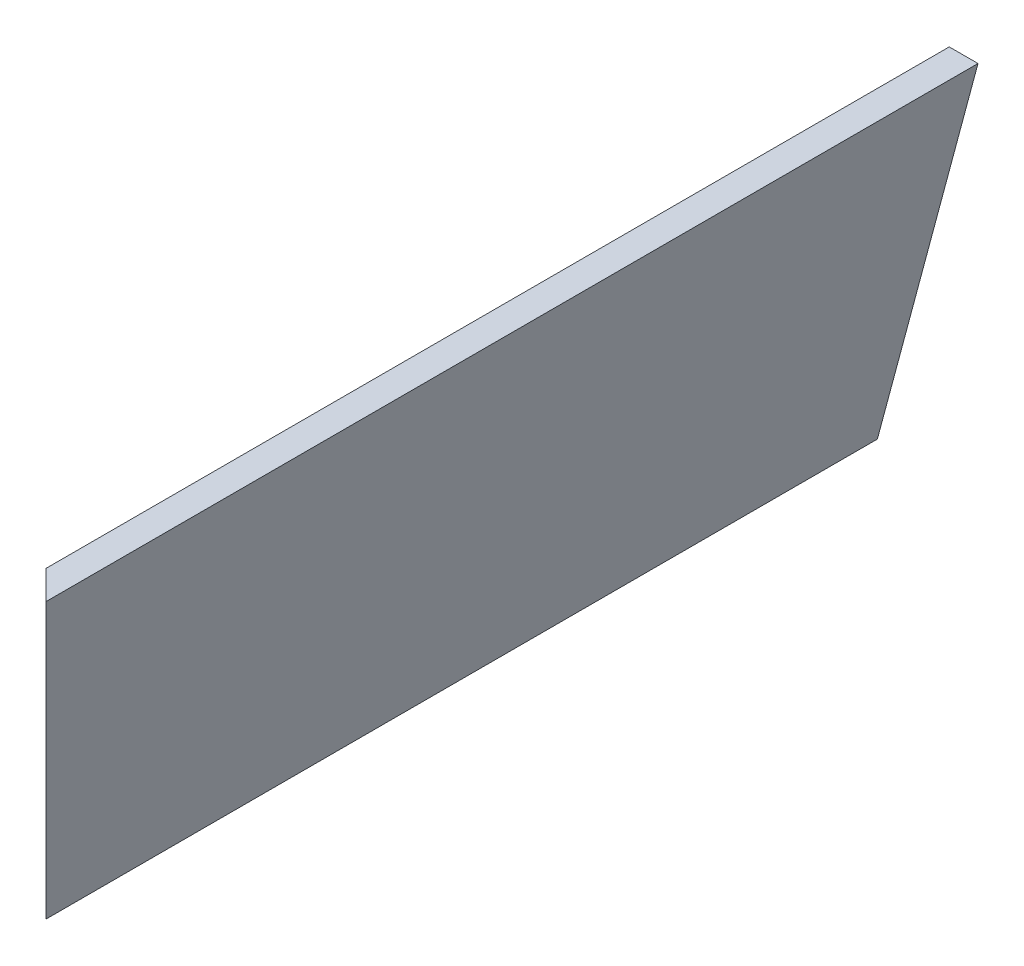
from build123d import *

# Parameters (mm, degrees)
BOSS_EXTRUDE1_REACH = 654.409


with BuildPart() as part:
    # Boss-Extrude1: up to this plane
    boss_extrude1_end = Plane(origin=(0, 0, 0), z_dir=(-0.7071067811865475, 0, 0.7071067811865477))
    # Sketch2 → Boss-Extrude1 (new, up to the surface)
    with BuildSketch(Plane.XY, mode=Mode.PRIVATE) as boss_extrude1_sk1:
        Polygon((366.937592509, 0), (380.0856, 0), (426.103626219, 171.741611914), (412.955618728, 171.741611914), align=None)
    boss_extrude1_tool1 = split(extrude(boss_extrude1_sk1.sketch, amount=BOSS_EXTRUDE1_REACH, mode=Mode.PRIVATE), bisect_by=boss_extrude1_end, keep=Keep.BOTH, mode=Mode.PRIVATE)
    add(boss_extrude1_tool1.solids().sort_by_distance((396.520609, 85.870806, 0))[0])


solid = part.part
